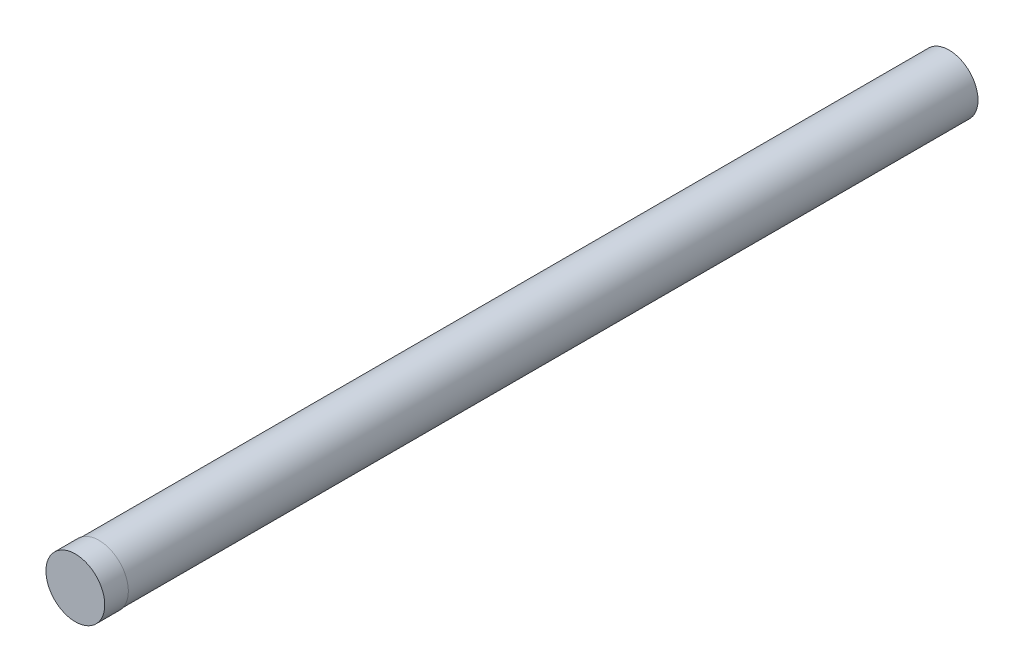
from build123d import *

# Parameters (mm, degrees)
BOSS_EXTRUDE1_DEPTH      = 10
BOSS_EXTRUDE1_DEPTH_BACK = 64
SKETCH1_R                = 2.45
SKETCH3_R                = 2.49
BOSS_EXTRUDE2_DEPTH      = 2


with BuildPart() as part:
    # Sketch1 → Boss-Extrude1 (new, two sides: drawn at the far end of the back side and taken through both)
    with BuildSketch(Plane.XY.offset(-BOSS_EXTRUDE1_DEPTH_BACK)):
        Circle(SKETCH1_R)
    extrude(amount=BOSS_EXTRUDE1_DEPTH + BOSS_EXTRUDE1_DEPTH_BACK)

    # Sketch3 → Boss-Extrude2 (add)
    with BuildSketch(Plane.XY.offset(10)):
        Circle(SKETCH3_R)
    extrude(amount=-BOSS_EXTRUDE2_DEPTH)


solid = part.part
